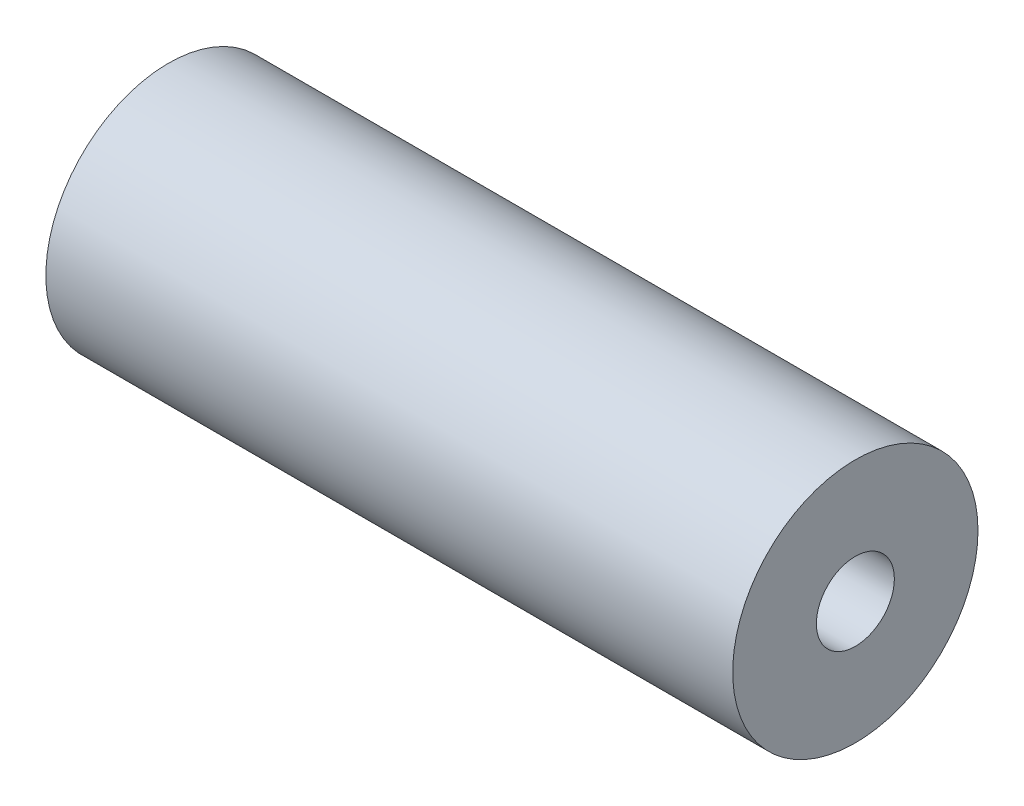
from build123d import *

# Parameters (mm, degrees)
SKETCH1_R           = 6.35
BOSS_EXTRUDE1_DEPTH = 17.78


with BuildPart() as part:
    # Sketch1 → Boss-Extrude1 (new, symmetric)
    with BuildSketch(Plane(origin=(0, 0, 0), x_dir=(0, 0, -1), z_dir=(1, 0, 0))):
        Circle(SKETCH1_R)
    extrude(amount=BOSS_EXTRUDE1_DEPTH, both=True)

    # Sketch4 → Tap Drill for #10-32 Tap1 (revolve, cut)
    with BuildSketch(Plane(origin=(17.78, 0, 0), x_dir=(0, 0, -1), z_dir=(0, 1, 0))):
        Polygon((0, 0), (0, 12.135317848), (2.0193, 10.922), (2.0193, 0), align=None)
    tap_drill_for_10_32_tap1 = revolve(axis=Axis((24.13, 0, 0), (-1, 0, 0)), mode=Mode.SUBTRACT)

    # Mirror1: Tap Drill for #10-32 Tap1 across plane
    add(tap_drill_for_10_32_tap1.mirror(Plane(origin=(0, 0, 0), x_dir=(0, 0, 1), z_dir=(1, 0, 0))), mode=Mode.SUBTRACT)


solid = part.part
